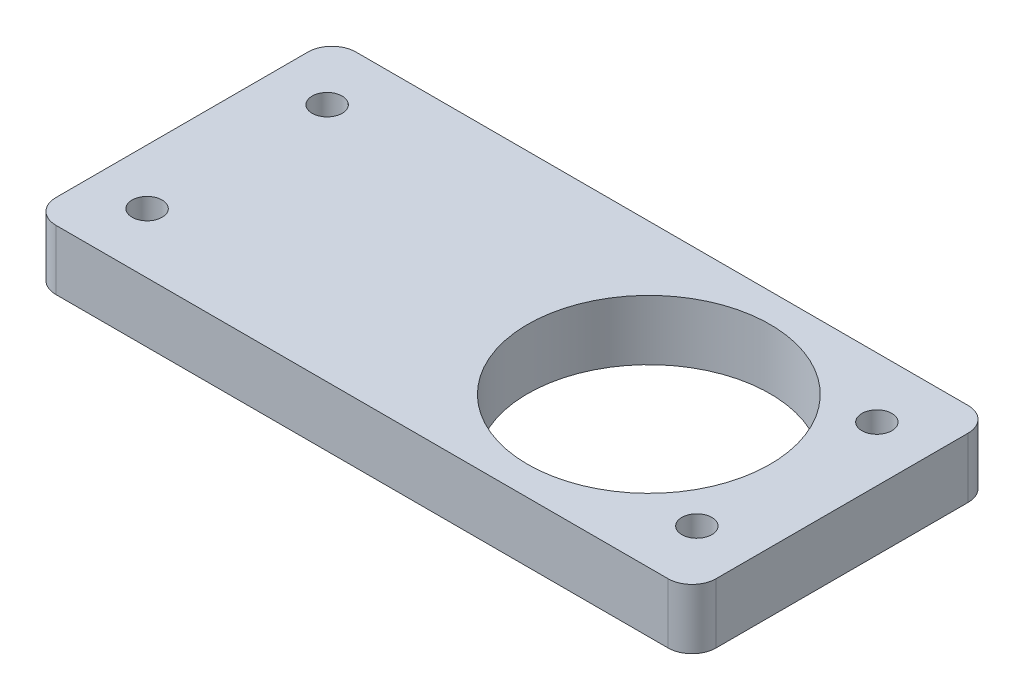
from build123d import *

# Parameters (mm, degrees)
SKETCH1_W           = 139.7
SKETCH1_H           = 63.5
SKETCH1_R           = 25.654
SKETCH1_R_2         = 3.175
BOSS_EXTRUDE1_DEPTH = 12.7
FILLET1_R           = 5.08


with BuildPart() as part:
    # Sketch1 → Boss-Extrude1 (new body)
    with BuildSketch(Plane(origin=(0, 0, 0), x_dir=(1, 0, 0), z_dir=(0, 1, 0))):
        Rectangle(SKETCH1_W, SKETCH1_H)
        with Locations((28.956, 0)):
            Circle(SKETCH1_R, mode=Mode.SUBTRACT)
        with Locations((-58.166, -19.05)):
            Circle(SKETCH1_R_2, mode=Mode.SUBTRACT)
        with Locations((-58.166, 19.05)):
            Circle(SKETCH1_R_2, mode=Mode.SUBTRACT)
        with Locations((58.166, 19.05)):
            Circle(SKETCH1_R_2, mode=Mode.SUBTRACT)
        with Locations((58.166, -19.05)):
            Circle(SKETCH1_R_2, mode=Mode.SUBTRACT)
    extrude(amount=BOSS_EXTRUDE1_DEPTH)

    # Fillet1
    fillet1_edges = [part.edges().sort_by_distance(p)[0] for p in [
        (-69.85, 6.35, -31.75),
        (69.85, 6.35, -31.75),
        (69.85, 6.35, 31.75),
        (-69.85, 6.35, 31.75),
    ]]
    fillet(fillet1_edges, radius=FILLET1_R)


solid = part.part
